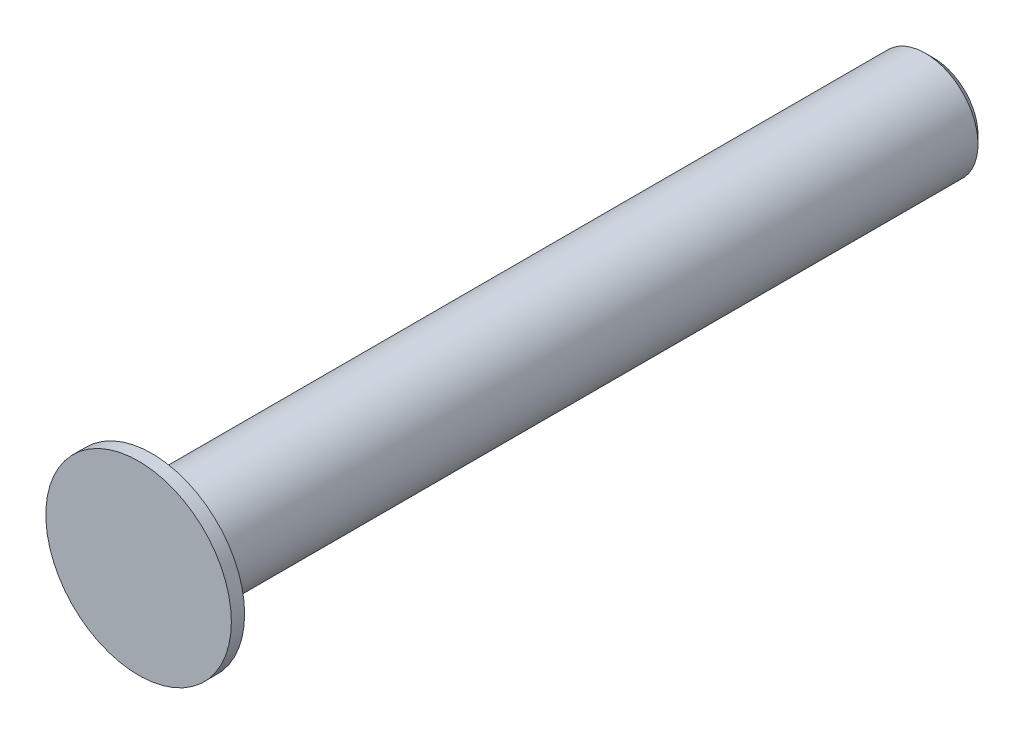
from build123d import *

# Parameters (mm, degrees)
SKETCH_1_R      = 7
EXTRUDE_2_DEPTH = 60


# Read off the part's stored shape, not the designer's step: 5/16-24 机械螺纹 螺柱1
with BuildPart() as part:
    # 草图1 → 凸台-拉伸2 (new body)
    with BuildSketch(Plane.XY):
        with Locations((-15.954071257, 29.682276751)):
            Circle(SKETCH_1_R)
    extrude(amount=EXTRUDE_2_DEPTH)

    # 5/16-24 机械螺纹 螺柱1 outline → 5/16-24 机械螺纹 螺柱1 (revolve, cut)
    with BuildSketch(Plane(origin=(-15.954071257, 29.682276751, 0), x_dir=(1, 0, 0), z_dir=(0, -1, 0))):
        Polygon((3.33883, 0), (7, 0), (7, 59), (3.96875, 59), (3.96875, 0.62992), align=None)
    revolve(axis=Axis((-15.954071257, 29.682276751, 0), (0, 0, 1)), mode=Mode.SUBTRACT)


solid = part.part
